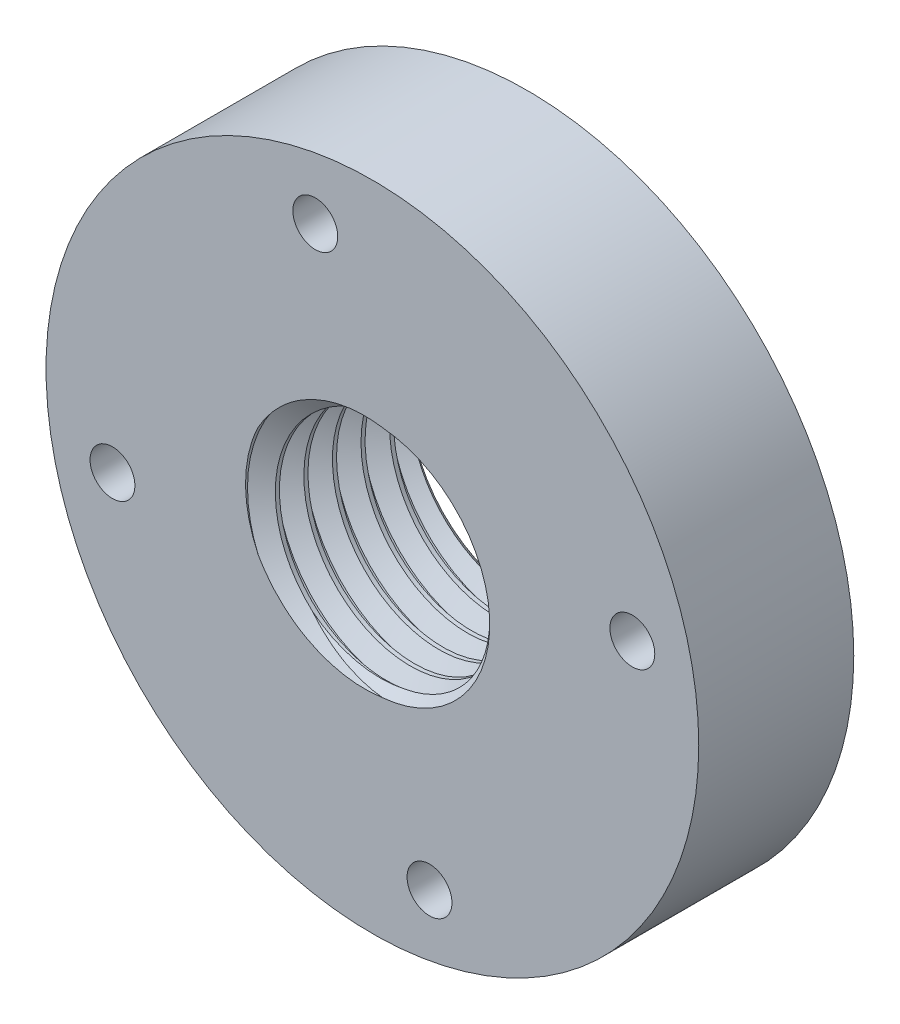
from build123d import *

# Parameters (mm, degrees)
BOSS_EXTRUDE1_DEPTH       = 19
SKETCH2_OUTSIDE_W         = 107.674
SKETCH2_OUTSIDE_H         = 100.558
SKETCH2_OUTSIDE_R         = 23
CUT_EXTRUDE1_DEPTH        = 19
CUT_EXTRUDE1_DRAFT        = -45
MIRROR1_COPY_1_SKETCH_W   = 107.674
MIRROR1_COPY_1_SKETCH_H   = 100.558
MIRROR1_COPY_1_SKETCH_R   = 23
MIRROR1_COPY_1_DEPTH      = 19
MIRROR1_COPY_1_DRAFT      = -45
SKETCH3_R                 = 13.3855
CUT_EXTRUDE2_DEPTH        = 40.94162407
CHAMFER1_SIZE             = 1
THREAD1_PITCH             = 3.5
BOSS_EXTRUDE2_START       = -19
BOSS_EXTRUDE2_OUTLINE_R   = 40
BOSS_EXTRUDE2_OUTLINE_R_2 = 23
BOSS_EXTRUDE2_OUTLINE_R_3 = 2.75
BOSS_EXTRUDE2_DEPTH       = 19


with BuildPart() as part:
    # Sketch1 → Boss-Extrude1 (new body)
    with BuildSketch(Plane.XY):
        Polygon((13.279056191, -23), (26.558112383, 0), (13.279056191, 23), (-13.279056191, 23), (-26.558112383, 0), (-13.279056191, -23), align=None)
    extrude(amount=BOSS_EXTRUDE1_DEPTH)


with BuildPart() as cut_extrude1_tool:
    # Sketch2 outside → Cut-Extrude1 (with draft: the straight prism first)
    with BuildSketch(Plane.XY.offset(19)):
        Rectangle(SKETCH2_OUTSIDE_W, SKETCH2_OUTSIDE_H)
        Circle(SKETCH2_OUTSIDE_R, mode=Mode.SUBTRACT)
    extrude(amount=-CUT_EXTRUDE1_DEPTH)
    # Cut-Extrude1: the draft: its side faces are tilted about the plane it starts from
    cut_extrude1_sides = [cut_extrude1_tool.faces().sort_by_distance(p)[0] for p in [
        (0, -50.279, 9.5),
        (53.837, 0, 9.5),
        (0, 50.279, 9.5),
        (-53.837, 0, 9.5),
        (-23, 0, 9.5),
    ]]
    draft(cut_extrude1_sides, Plane.XY.offset(19), CUT_EXTRUDE1_DRAFT)


with BuildPart() as part_1:
    add(part.part)

    # Cut-Extrude1: cut by cut_extrude1_tool
    add(cut_extrude1_tool.part, mode=Mode.SUBTRACT)


with BuildPart() as mirror1_copy_1_tool:
    # Mirror1 copy 1 sketch → Mirror1 copy 1 (with draft: the straight prism first)
    with BuildSketch(Plane(origin=(0, 0, 0), x_dir=(1, 0, 0), z_dir=(0, 0, -1))):
        Rectangle(MIRROR1_COPY_1_SKETCH_W, MIRROR1_COPY_1_SKETCH_H)
        Circle(MIRROR1_COPY_1_SKETCH_R, mode=Mode.SUBTRACT)
    extrude(amount=-MIRROR1_COPY_1_DEPTH)
    # Mirror1 copy 1: the draft: its side faces are tilted about the plane it starts from
    mirror1_copy_1_sides = [mirror1_copy_1_tool.faces().sort_by_distance(p)[0] for p in [
        (0, -50.279, 9.5),
        (53.837, 0, 9.5),
        (0, 50.279, 9.5),
        (-53.837, 0, 9.5),
        (-23, 0, 9.5),
    ]]
    draft(mirror1_copy_1_sides, Plane(origin=(0, 0, 0), x_dir=(1, 0, 0), z_dir=(0, 0, -1)), MIRROR1_COPY_1_DRAFT)


with BuildPart() as part_2:
    add(part_1.part)

    # Mirror1 copy 1: cut by mirror1_copy_1_tool
    add(mirror1_copy_1_tool.part, mode=Mode.SUBTRACT)

    # Sketch3 → Cut-Extrude2 (cut, through all)
    with BuildSketch(Plane.XY.offset(19)):
        Circle(SKETCH3_R)
    extrude(amount=-CUT_EXTRUDE2_DEPTH, mode=Mode.SUBTRACT)

    # Chamfer1
    chamfer1_edges = [part_2.edges().sort_by_distance(p)[0] for p in [
        (-13.3855, 0, 0),
        (-13.3855, 0, 19),
    ]]
    chamfer(chamfer1_edges, length=CHAMFER1_SIZE)

    # Thread1: arcs per turn and ends read off the stored shape
    # Thread1: the profile of Thread Profile1 profile screwed along a right-hand helix through 8.571429 turns, 12 arcs to a turn; built about Z, then put on its axis
    thread1_z = Axis((0, 0, 0), (0, 0, 1))
    thread1_corners = [(13.3852, 0, -0.000173205), (15.5505635, 0, 1.249999995), (15.5505635, 0, 1.749999995), (13.3852, 0, 3.000173194)]
    with BuildLine(mode=Mode.PRIVATE) as thread1_profile:
        Line(thread1_corners[0], thread1_corners[1])
        Line(thread1_corners[1], thread1_corners[2])
        Line(thread1_corners[2], thread1_corners[3])
        Line(thread1_corners[3], thread1_corners[0])
    thread1_cap = Face(thread1_profile.wire())
    thread1_turn_angles = [0, 15, 30, 45, 60, 75, 90, 105, 120, 135, 150, 165, 180, 195, 210, 225, 240, 255, 270, 285, 300, 315, 330, 345, 360]
    thread1_turn_weights = [1, 0.9659258262890683, 1, 0.9659258262890683, 1, 0.9659258262890683, 1, 0.9659258262890683, 1, 0.9659258262890683, 1, 0.9659258262890683, 1, 0.9659258262890683, 1, 0.9659258262890683, 1, 0.9659258262890683, 1, 0.9659258262890683, 1, 0.9659258262890683, 1, 0.9659258262890683, 1]
    thread1_turn_rails = [Edge.make_bspline([Vector(p[0], p[1], 0).rotate(thread1_z, thread1_turn_angles[k]) / thread1_turn_weights[k] + Vector(0, 0, p[2] + THREAD1_PITCH * thread1_turn_angles[k] / 360) for k in range(25)], [0, 0, 0, 1, 1, 2, 2, 3, 3, 4, 4, 5, 5, 6, 6, 7, 7, 8, 8, 9, 9, 10, 10, 11, 11, 12, 12, 12], 2, thread1_turn_weights) for p in thread1_corners]
    thread1_turn_sides = [Face.make_surface_from_curves(thread1_turn_rails[p[0]], thread1_turn_rails[p[1]]) for p in [(0, 1), (1, 2), (2, 3), (3, 0)]]
    thread1_last_angles = [2880, 2895, 2910, 2925, 2940, 2955, 2970, 2985, 3000, 3015, 3030, 3045, 3060, 3072.857142857, 3085.714285714]
    thread1_last_weights = [1, 0.9659258262890683, 1, 0.9659258262890683, 1, 0.9659258262890683, 1, 0.9659258262890683, 1, 0.9659258262890683, 1, 0.9659258262890683, 1, 0.97492791218182, 1]
    thread1_last_rails = [Edge.make_bspline([Vector(p[0], p[1], 0).rotate(thread1_z, thread1_last_angles[k]) / thread1_last_weights[k] + Vector(0, 0, p[2] + THREAD1_PITCH * thread1_last_angles[k] / 360) for k in range(15)], [0, 0, 0, 1, 1, 2, 2, 3, 3, 4, 4, 5, 5, 6, 6, 7, 7, 7], 2, thread1_last_weights) for p in thread1_corners]
    thread1_last_sides = [Face.make_surface_from_curves(thread1_last_rails[p[0]], thread1_last_rails[p[1]]) for p in [(0, 1), (1, 2), (2, 3), (3, 0)]]
    thread1 = Plane(origin=(0, 0, 31), x_dir=(-1, 0, 0), z_dir=(0, 0, -1)) * Solid(Shell([*[p.moved(Location((0, 0, THREAD1_PITCH * i))) for i in range(8) for p in thread1_turn_sides], *thread1_last_sides, thread1_cap, thread1_cap.rotate(thread1_z, 3085.714285714).moved(Location((0, 0, THREAD1_PITCH * 3085.714285714 / 360)))]))
    add(thread1, mode=Mode.SUBTRACT)

    # Boss-Extrude2: read off the stored shape, not the designer's step
    # Boss-Extrude2 outline → Boss-Extrude2 (add)
    with BuildSketch(Plane.XY.offset(19).offset(BOSS_EXTRUDE2_START)):
        Circle(BOSS_EXTRUDE2_OUTLINE_R)
        Circle(BOSS_EXTRUDE2_OUTLINE_R_2, mode=Mode.SUBTRACT)
        with Locations((6.997189952, -31.859519372)):
            Circle(BOSS_EXTRUDE2_OUTLINE_R_3, mode=Mode.SUBTRACT)
        with Locations((31.859519372, 6.997189952)):
            Circle(BOSS_EXTRUDE2_OUTLINE_R_3, mode=Mode.SUBTRACT)
        with Locations((-31.859519372, -6.997189952)):
            Circle(BOSS_EXTRUDE2_OUTLINE_R_3, mode=Mode.SUBTRACT)
        with Locations((-6.997189952, 31.859519372)):
            Circle(BOSS_EXTRUDE2_OUTLINE_R_3, mode=Mode.SUBTRACT)
    extrude(amount=BOSS_EXTRUDE2_DEPTH)


solid = part_2.part
